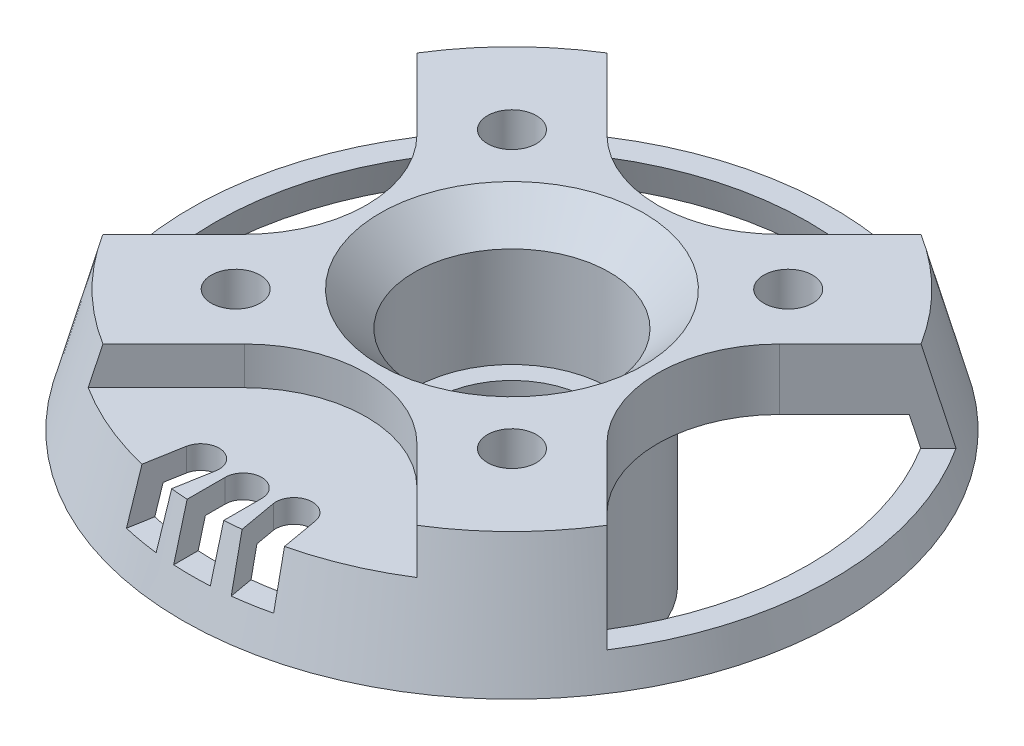
from build123d import *

# Parameters (mm, degrees)
SKETCH1_R                   = 13.5
BASE_SIZE_DEPTH             = 5
MOUNTING_HOLES_REACH        = 21.736
SKETCH2_R                   = 1
SKETCH3_R                   = 12.5
ROTOR_POCKET_DEPTH          = 2.5
ROTOR_POCKET_DRAFT          = -15
OUTSIDE_CHAMFER_SIZE        = 5
OUTSIDE_CHAMFER_SIZE_2      = 1.339745962
BOTTOM_POCKETS_TOP_DEPTH    = 1.55
BOTTOM_POCKETS_BOTTOM_DEPTH = 2.15
BOTTOM_POCKETS_FILLET_R     = 5
CUT_EXTRUDE5_REACH          = 21.736
SKETCH6_R                   = 4
CHAMFER2_SIZE               = 1.4
SKETCH7_R                   = 4.8
SKETCH7_R_2                 = 4
BEARING_BOTTOM_DEPTH        = 3
SKETCH8_R                   = 4.8
SKETCH8_R_2                 = 3.2
BEARING_SEPARATOR_DEPTH     = 1
SKETCH9_R                   = 4.8
SKETCH9_R_2                 = 4
BEARING_TOP_DEPTH           = 4
CUT_EXTRUDE6_DEPTH          = 2.05


with BuildPart() as part:
    # Sketch1 → Base size (new body)
    with BuildSketch(Plane(origin=(0, 0, 0), x_dir=(1, 0, 0), z_dir=(0, 1, 0))):
        with Locations(Location((0, 0, 0), (0, 0, 270))):
            Circle(SKETCH1_R)
    extrude(amount=BASE_SIZE_DEPTH)

    # Sketch2 → Mounting holes (cut, up to next)
    with BuildSketch(Plane(origin=(0, 5, 0), x_dir=(1, 0, 0), z_dir=(0, 1, 0)), mode=Mode.PRIVATE) as mounting_holes_sk1:
        with Locations(Location((5.656854249, 5.656854249, 0), (0, 0, 270))):
            Circle(SKETCH2_R)
    mounting_holes_tool1 = extrude(mounting_holes_sk1.sketch, amount=-MOUNTING_HOLES_REACH, mode=Mode.PRIVATE) & part.part
    # Sketch2 → Mounting holes (cut, up to next)
    with BuildSketch(Plane(origin=(0, 5, 0), x_dir=(1, 0, 0), z_dir=(0, 1, 0)), mode=Mode.PRIVATE) as mounting_holes_sk2:
        with Locations(Location((-5.656854249, -5.656854249, 0), (0, 0, 270))):
            Circle(SKETCH2_R)
    mounting_holes_tool2 = extrude(mounting_holes_sk2.sketch, amount=-MOUNTING_HOLES_REACH, mode=Mode.PRIVATE) & part.part
    # Sketch2 → Mounting holes (cut, up to next)
    with BuildSketch(Plane(origin=(0, 5, 0), x_dir=(1, 0, 0), z_dir=(0, 1, 0)), mode=Mode.PRIVATE) as mounting_holes_sk3:
        with Locations(Location((5.656854249, -5.656854249, 0), (0, 0, 270))):
            Circle(SKETCH2_R)
    mounting_holes_tool3 = extrude(mounting_holes_sk3.sketch, amount=-MOUNTING_HOLES_REACH, mode=Mode.PRIVATE) & part.part
    # Sketch2 → Mounting holes (cut, up to next)
    with BuildSketch(Plane(origin=(0, 5, 0), x_dir=(1, 0, 0), z_dir=(0, 1, 0)), mode=Mode.PRIVATE) as mounting_holes_sk4:
        with Locations(Location((-5.656854249, 5.656854249, 0), (0, 0, 270))):
            Circle(SKETCH2_R)
    mounting_holes_tool4 = extrude(mounting_holes_sk4.sketch, amount=-MOUNTING_HOLES_REACH, mode=Mode.PRIVATE) & part.part
    add(mounting_holes_tool1.solids().sort_by_distance((5.656854, 5, -5.656854))[0], mode=Mode.SUBTRACT)
    add(mounting_holes_tool2.solids().sort_by_distance((-5.656854, 5, 5.656854))[0], mode=Mode.SUBTRACT)
    add(mounting_holes_tool3.solids().sort_by_distance((5.656854, 5, 5.656854))[0], mode=Mode.SUBTRACT)
    add(mounting_holes_tool4.solids().sort_by_distance((-5.656854, 5, -5.656854))[0], mode=Mode.SUBTRACT)


with BuildPart() as rotor_pocket_tool:
    # Sketch3 → Rotor pocket (with draft: the straight prism first)
    with BuildSketch(Plane.XZ):
        Circle(SKETCH3_R)
    extrude(amount=-ROTOR_POCKET_DEPTH)
    # Rotor pocket: the draft: its side faces are tilted about the plane it starts from
    rotor_pocket_sides = [rotor_pocket_tool.faces().sort_by_distance(p)[0] for p in [
        (-12.5, 1.25, 0),
    ]]
    draft(rotor_pocket_sides, Plane.XZ, ROTOR_POCKET_DRAFT)


with BuildPart() as part_1:
    add(part.part)

    # Rotor pocket: cut by rotor_pocket_tool
    add(rotor_pocket_tool.part, mode=Mode.SUBTRACT)

    # Outside chamfer
    # the kernel refuses this chamfer: 5, 1.339745962 mm, written as the material it takes off along each edge
    with BuildSketch(Plane(origin=(0, 5, 0), x_dir=(0, 0, 1), z_dir=(-1, 0, 0))) as outside_chamfer_piece_1:
        Polygon((13.5, -OUTSIDE_CHAMFER_SIZE), (13.5 - OUTSIDE_CHAMFER_SIZE_2, 0), (13.5, 0), align=None)
    revolve(axis=Axis((0, 5, 0), (0, 1, 0)), mode=Mode.SUBTRACT)

    # Sketch4 → Bottom pockets top (cut)
    with BuildSketch(Plane(origin=(0, 5, 0), x_dir=(1, 0, 0), z_dir=(0, 1, 0))):
        with BuildLine():
            Line((-3.889087297, 0), (-10.320380271, 6.431292975))
            ThreePointArc((-10.320380271, 6.431292975), (-12.160254038, 0), (-10.320380271, -6.431292975))
            Line((-10.320380271, -6.431292975), (-3.889087297, 0))
        make_face()
        with BuildLine():
            Line((-10.320380271, 6.431292975), (-10.543141739, 6.654054443))
            Line((-10.543141739, 6.654054443), (-11.29033147, 7.401244173))
            ThreePointArc((-11.29033147, 7.401244173), (-13.5, 0), (-11.29033147, -7.401244173))
            Line((-11.29033147, -7.401244173), (-10.543141739, -6.654054443))
            Line((-10.543141739, -6.654054443), (-10.320380271, -6.431292975))
            ThreePointArc((-10.320380271, -6.431292975), (-12.160254038, 0), (-10.320380271, 6.431292975))
        make_face()
        with BuildLine():
            ThreePointArc((6.431292975, 10.320380271), (0, 12.160254038), (-6.431292975, 10.320380271))
            Line((-6.431292975, 10.320380271), (0, 3.889087297))
            Line((0, 3.889087297), (6.431292975, 10.320380271))
        make_face()
        with BuildLine():
            Line((-6.654054443, 10.543141739), (-6.431292975, 10.320380271))
            ThreePointArc((-6.431292975, 10.320380271), (0, 12.160254038), (6.431292975, 10.320380271))
            Line((6.431292975, 10.320380271), (6.654054443, 10.543141739))
            Line((6.654054443, 10.543141739), (7.401244173, 11.29033147))
            ThreePointArc((7.401244173, 11.29033147), (0, 13.5), (-7.401244173, 11.29033147))
            Line((-7.401244173, 11.29033147), (-6.654054443, 10.543141739))
        make_face()
        with BuildLine():
            Line((10.320380271, 6.431292975), (3.889087297, 0))
            Line((3.889087297, 0), (10.320380271, -6.431292975))
            ThreePointArc((10.320380271, -6.431292975), (11.691240827, -3.344647396), (12.160254038, 0))
            ThreePointArc((12.160254038, 0), (11.691240827, 3.344647396), (10.320380271, 6.431292975))
        make_face()
        with BuildLine():
            Line((10.543141739, 6.654054443), (10.320380271, 6.431292975))
            ThreePointArc((10.320380271, 6.431292975), (11.691240827, 3.344647396), (12.160254038, 0))
            ThreePointArc((12.160254038, 0), (11.691240827, -3.344647396), (10.320380271, -6.431292975))
            Line((10.320380271, -6.431292975), (10.543141739, -6.654054443))
            Line((10.543141739, -6.654054443), (11.29033147, -7.401244173))
            ThreePointArc((11.29033147, -7.401244173), (12.935792879, -3.862028299), (13.5, 0))
            ThreePointArc((13.5, 0), (12.935792879, 3.862028299), (11.29033147, 7.401244173))
            Line((11.29033147, 7.401244173), (10.543141739, 6.654054443))
        make_face()
        with BuildLine():
            ThreePointArc((6.431292975, -10.320380271), (0, -12.160254038), (-6.431292975, -10.320380271))
            Line((-6.431292975, -10.320380271), (-6.654054443, -10.543141739))
            Line((-6.654054443, -10.543141739), (-7.401244173, -11.29033147))
            ThreePointArc((-7.401244173, -11.29033147), (0, -13.5), (7.401244173, -11.29033147))
            Line((7.401244173, -11.29033147), (6.654054443, -10.543141739))
            Line((6.654054443, -10.543141739), (6.431292975, -10.320380271))
        make_face()
        with BuildLine():
            Line((6.431292975, -10.320380271), (0, -3.889087297))
            Line((0, -3.889087297), (-6.431292975, -10.320380271))
            ThreePointArc((-6.431292975, -10.320380271), (0, -12.160254038), (6.431292975, -10.320380271))
        make_face()
    extrude(amount=-BOTTOM_POCKETS_TOP_DEPTH, mode=Mode.SUBTRACT)

    # Sketch5 → Bottom pockets bottom (cut)
    with BuildSketch(Plane(origin=(0, 3.45, 0), x_dir=(1, 0, 0), z_dir=(0, 1, 0))):
        with BuildLine():
            ThreePointArc((-10.621599421, 6.732512125), (-12.575575286, 0), (-10.621599421, -6.732512125))
            Line((-10.621599421, -6.732512125), (-3.889087297, 0))
            Line((-3.889087297, 0), (-10.621599421, 6.732512125))
        make_face()
        with BuildLine():
            Line((-10.621599421, 6.732512125), (-11.29033147, 7.401244173))
            ThreePointArc((-11.29033147, 7.401244173), (-13.5, 0), (-11.29033147, -7.401244173))
            Line((-11.29033147, -7.401244173), (-10.621599421, -6.732512125))
            ThreePointArc((-10.621599421, -6.732512125), (-12.575575286, 0), (-10.621599421, 6.732512125))
        make_face()
        with BuildLine():
            ThreePointArc((7.401244173, 11.29033147), (0, 13.5), (-7.401244173, 11.29033147))
            Line((-7.401244173, 11.29033147), (0, 3.889087297))
            Line((0, 3.889087297), (7.401244173, 11.29033147))
        make_face()
        with BuildLine():
            Line((11.29033147, 7.401244173), (3.889087297, 0))
            Line((3.889087297, 0), (11.29033147, -7.401244173))
            ThreePointArc((11.29033147, -7.401244173), (12.935792879, -3.862028299), (13.5, 0))
            ThreePointArc((13.5, 0), (12.935792879, 3.862028299), (11.29033147, 7.401244173))
        make_face()
    extrude(amount=-BOTTOM_POCKETS_BOTTOM_DEPTH, mode=Mode.SUBTRACT)

    # Bottom pockets fillet
    bottom_pockets_fillet_edges = [part_1.edges().sort_by_distance(p)[0] for p in [
        (-3.889087297, 3.75, 0),
        (3.889087297, 3.75, 0),
        (0, 4.225, 3.889087297),
        (0, 3.75, -3.889087297),
    ]]
    fillet(bottom_pockets_fillet_edges, radius=BOTTOM_POCKETS_FILLET_R)

    # Sketch6 → Cut-Extrude5 (cut, up to next)
    with BuildSketch(Plane(origin=(0, 5, 0), x_dir=(1, 0, 0), z_dir=(0, 1, 0)), mode=Mode.PRIVATE) as cut_extrude5_sk1:
        with Locations(Location((0, 0, 0), (0, 0, 270))):
            Circle(SKETCH6_R)
    cut_extrude5_tool1 = extrude(cut_extrude5_sk1.sketch, amount=-CUT_EXTRUDE5_REACH, mode=Mode.PRIVATE) & part_1.part
    add(cut_extrude5_tool1.solids().sort_by_distance((0, 5, 0))[0], mode=Mode.SUBTRACT)

    # Chamfer2
    chamfer2_edges = [part_1.edges().sort_by_distance(p)[0] for p in [
        (0, 5, -4),
    ]]
    chamfer(chamfer2_edges, length=CHAMFER2_SIZE)

    # Sketch7 → Bearing bottom (add)
    with BuildSketch(Plane.XZ.offset(-2.5)):
        with Locations(Location((0, 0, 0), (0, 0, 270))):
            Circle(SKETCH7_R)
        with Locations(Location((0, 0, 0), (0, 0, 90))):
            Circle(SKETCH7_R_2, mode=Mode.SUBTRACT)
    extrude(amount=BEARING_BOTTOM_DEPTH)

    # Sketch8 → Bearing separator (add)
    with BuildSketch(Plane.XZ.offset(0.5)):
        with Locations(Location((0, 0, 0), (0, 0, 270))):
            Circle(SKETCH8_R)
        with Locations(Location((0, 0, 0), (0, 0, 270))):
            Circle(SKETCH8_R_2, mode=Mode.SUBTRACT)
    extrude(amount=BEARING_SEPARATOR_DEPTH)

    # Sketch9 → Bearing top (add)
    with BuildSketch(Plane.XZ.offset(1.5)):
        with Locations(Location((0, 0, 0), (0, 0, 270))):
            Circle(SKETCH9_R)
        with Locations(Location((0, 0, 0), (0, 0, 90))):
            Circle(SKETCH9_R_2, mode=Mode.SUBTRACT)
    extrude(amount=BEARING_TOP_DEPTH)

    # Sketch10 → Cut-Extrude6 (cut)
    with BuildSketch(Plane(origin=(0, 3.45, 0), x_dir=(1, 0, 0), z_dir=(0, 1, 0))):
        with BuildLine():
            ThreePointArc((-1.167513596, -10.937865971), (-1.779893821, -10.094279468), (-2.643866576, -10.677545108))
            Line((-2.643866576, -10.677545108), (-3.078810633, -13.144235432))
            ThreePointArc((-3.078810633, -13.144235432), (-2.344250399, -13.294904666), (-1.602457654, -13.404556295))
            Line((-1.602457654, -13.404556295), (-1.167513596, -10.937865971))
        make_face()
        with BuildLine():
            ThreePointArc((2.643866576, -10.677545108), (1.779893821, -10.094279468), (1.167513596, -10.937865971))
            Line((1.167513596, -10.937865971), (1.602457654, -13.404556295))
            ThreePointArc((1.602457654, -13.404556295), (2.344250399, -13.294904666), (3.078810633, -13.144235432))
            Line((3.078810633, -13.144235432), (2.643866576, -10.677545108))
        make_face()
        with BuildLine():
            Line((-0.75, -11), (-0.75, -13.479150567))
            ThreePointArc((-0.75, -13.479150567), (0, -13.5), (0.75, -13.479150567))
            Line((0.75, -13.479150567), (0.75, -11))
            ThreePointArc((0.75, -11), (0, -10.25), (-0.75, -11))
        make_face()
    extrude(amount=-CUT_EXTRUDE6_DEPTH, mode=Mode.SUBTRACT)


solid = part_1.part
